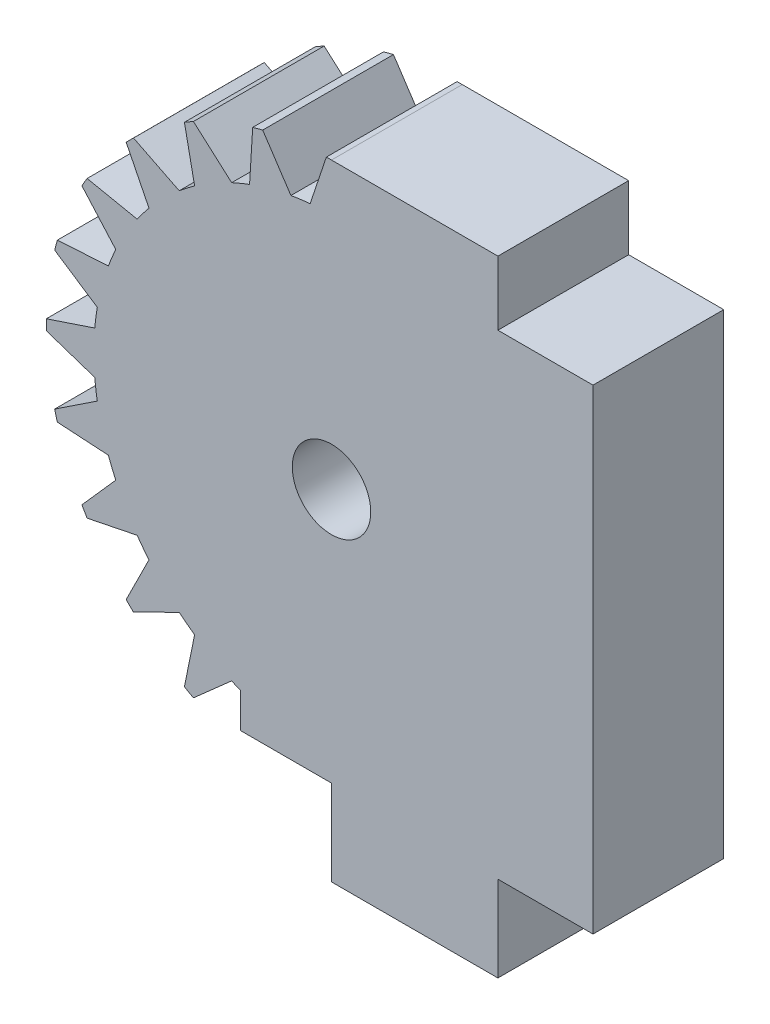
from build123d import *

# Parameters (mm, degrees)
SKETCH1_R           = 10
BOSS_EXTRUDE1_DEPTH = 5.5
BOSS_EXTRUDE2_DEPTH = 5.5
CIRPATTERN1_COUNT   = 24
SKETCH3_R           = 12.65
SKETCH3_R_2         = 12
CUT_EXTRUDE1_DEPTH  = 6
CUT_EXTRUDE2_DEPTH  = 6
SKETCH5_R           = 1.65
CUT_EXTRUDE3_DEPTH  = 6
BOSS_EXTRUDE3_DEPTH = 5.5


with BuildPart() as part:
    # Sketch1 → Boss-Extrude1 (new body)
    with BuildSketch(Plane.XY):
        Circle(SKETCH1_R)
    extrude(amount=BOSS_EXTRUDE1_DEPTH)

    # Sketch2 → Boss-Extrude2 (add)
    with BuildSketch(Plane.XY):
        with BuildLine():
            Line((0, 12.65), (-0.9, 9.959417654))
            ThreePointArc((-0.9, 9.959417654), (0, 10), (0.9, 9.959417654))
            Line((0.9, 9.959417654), (0, 12.65))
        make_face()
    boss_extrude2 = extrude(amount=BOSS_EXTRUDE2_DEPTH)

    # CirPattern1: Boss-Extrude2 ×24 about axis
    cirpattern1_axis = Axis((0, 0, 5.5), (0, 0, 1))
    for i in range(1, CIRPATTERN1_COUNT):
        add(boss_extrude2.rotate(cirpattern1_axis, i * 360 / CIRPATTERN1_COUNT))

    # Sketch3 → Cut-Extrude1 (cut)
    with BuildSketch(Plane.XY):
        Circle(SKETCH3_R)
        Circle(SKETCH3_R_2, mode=Mode.SUBTRACT)
    extrude(amount=CUT_EXTRUDE1_DEPTH, mode=Mode.SUBTRACT)

    # Sketch4 → Cut-Extrude2 (cut)
    with BuildSketch(Plane.XY):
        with BuildLine():
            Line((0, 0), (0, 12))
            ThreePointArc((0, 12), (11.769423365, -2.341083864), (-4.592201188, -11.08655439))
            Line((-4.592201188, -11.08655439), (-3.826834324, -9.238795325))
            Line((-3.826834324, -9.238795325), (0, 0))
        make_face()
    extrude(amount=CUT_EXTRUDE2_DEPTH, mode=Mode.SUBTRACT)

    # Sketch5 → Cut-Extrude3 (cut)
    with BuildSketch(Plane.XY):
        Circle(SKETCH5_R)
    extrude(amount=CUT_EXTRUDE3_DEPTH, mode=Mode.SUBTRACT)

    # Sketch6 → Boss-Extrude3 (add)
    with BuildSketch(Plane.XY):
        with BuildLine():
            Line((0, 1.65), (0, 12))
            Line((0, 12), (7, 12))
            Line((7, 12), (7, 9.3))
            Line((7, 9.3), (11, 9.3))
            Line((11, 9.3), (11, -10.7))
            Line((11, -10.7), (7, -10.7))
            Line((7, -10.7), (7, -14.3))
            Line((7, -14.3), (0, -14.3))
            Line((0, -14.3), (0, -10.7))
            Line((0, -10.7), (-3.826834324, -10.7))
            Line((-3.826834324, -10.7), (-3.826834324, -9.238795325))
            Line((-3.826834324, -9.238795325), (-0.631427663, -1.524401229))
            ThreePointArc((-0.631427663, -1.524401229), (1.618295713, -0.321899031), (0, 1.65))
        make_face()
    extrude(amount=BOSS_EXTRUDE3_DEPTH)


solid = part.part
